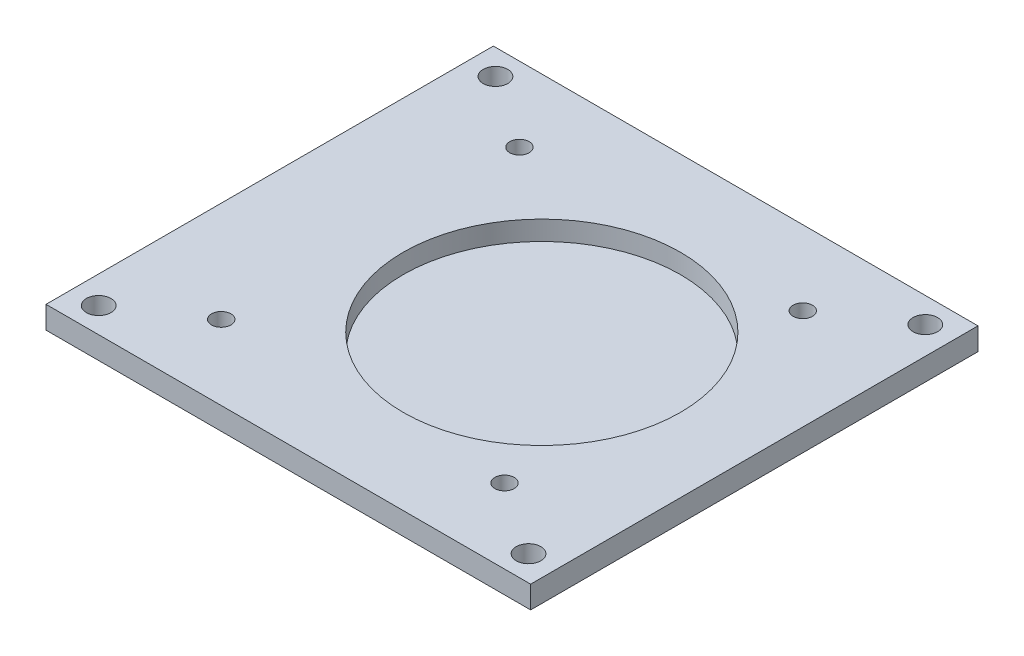
from build123d import *

# Parameters (mm, degrees)
SKETCH3_W           = 65
SKETCH3_H           = 60
BOSS_EXTRUDE3_DEPTH = 3
CUT_EXTRUDE1_REACH  = 57.839
SKETCH4_R           = 1.3
SKETCH9_R           = 3.2
SKETCH9_R_2         = 1.6
BOSS_EXTRUDE5_DEPTH = 5.6
SKETCH10_R          = 18.6
CUT_EXTRUDE3_DEPTH  = 2.6
SKETCH11_R          = 1.65
CUT_EXTRUDE4_DEPTH  = 57.41772771
FILLET1_R           = 1


with BuildPart() as part:
    # Sketch3 → Boss-Extrude3 (new body)
    with BuildSketch(Plane(origin=(0, 0, 0), x_dir=(1, 0, 0), z_dir=(0, 1, 0))):
        with Locations((-14.5, 0)):
            Rectangle(SKETCH3_W, SKETCH3_H)
    extrude(amount=BOSS_EXTRUDE3_DEPTH)

    # Sketch4 → Cut-Extrude1 (cut, up to next)
    with BuildSketch(Plane(origin=(0, 3, 0), x_dir=(1, 0, 0), z_dir=(0, 1, 0)), mode=Mode.PRIVATE) as cut_extrude1_sk1:
        with Locations((-33.5, 20)):
            Circle(SKETCH4_R)
    cut_extrude1_tool1 = extrude(cut_extrude1_sk1.sketch, amount=-CUT_EXTRUDE1_REACH, mode=Mode.PRIVATE) & part.part
    # Sketch4 → Cut-Extrude1 (cut, up to next)
    with BuildSketch(Plane(origin=(0, 3, 0), x_dir=(1, 0, 0), z_dir=(0, 1, 0)), mode=Mode.PRIVATE) as cut_extrude1_sk2:
        with Locations((4.5, 20)):
            Circle(SKETCH4_R)
    cut_extrude1_tool2 = extrude(cut_extrude1_sk2.sketch, amount=-CUT_EXTRUDE1_REACH, mode=Mode.PRIVATE) & part.part
    # Sketch4 → Cut-Extrude1 (cut, up to next)
    with BuildSketch(Plane(origin=(0, 3, 0), x_dir=(1, 0, 0), z_dir=(0, 1, 0)), mode=Mode.PRIVATE) as cut_extrude1_sk3:
        with Locations((4.5, -20)):
            Circle(SKETCH4_R)
    cut_extrude1_tool3 = extrude(cut_extrude1_sk3.sketch, amount=-CUT_EXTRUDE1_REACH, mode=Mode.PRIVATE) & part.part
    # Sketch4 → Cut-Extrude1 (cut, up to next)
    with BuildSketch(Plane(origin=(0, 3, 0), x_dir=(1, 0, 0), z_dir=(0, 1, 0)), mode=Mode.PRIVATE) as cut_extrude1_sk4:
        with Locations((-33.5, -20)):
            Circle(SKETCH4_R)
    cut_extrude1_tool4 = extrude(cut_extrude1_sk4.sketch, amount=-CUT_EXTRUDE1_REACH, mode=Mode.PRIVATE) & part.part
    add(cut_extrude1_tool1.solids().sort_by_distance((-33.5, 3, -20))[0], mode=Mode.SUBTRACT)
    add(cut_extrude1_tool2.solids().sort_by_distance((4.5, 3, -20))[0], mode=Mode.SUBTRACT)
    add(cut_extrude1_tool3.solids().sort_by_distance((4.5, 3, 20))[0], mode=Mode.SUBTRACT)
    add(cut_extrude1_tool4.solids().sort_by_distance((-33.5, 3, 20))[0], mode=Mode.SUBTRACT)

    # Sketch9 → Boss-Extrude5 (add)
    # profile 1 of 4: a face of its own
    with BuildSketch(Plane.XZ):
        with Locations((-33.5, 20)):
            Circle(SKETCH9_R)
        with Locations((-33.5, 20)):
            Circle(SKETCH9_R_2, mode=Mode.SUBTRACT)
    # profile 2 of 4: a face of its own
    with BuildSketch(Plane.XZ):
        with Locations((-33.5, -20)):
            Circle(SKETCH9_R)
        with Locations((-33.5, -20)):
            Circle(SKETCH9_R_2, mode=Mode.SUBTRACT)
    # profile 3 of 4: a face of its own
    with BuildSketch(Plane.XZ):
        with Locations((4.5, 20)):
            Circle(SKETCH9_R)
        with Locations((4.5, 20)):
            Circle(SKETCH9_R_2, mode=Mode.SUBTRACT)
    # profile 4 of 4: a face of its own
    with BuildSketch(Plane.XZ):
        with Locations((4.5, -20)):
            Circle(SKETCH9_R)
        with Locations((4.5, -20)):
            Circle(SKETCH9_R_2, mode=Mode.SUBTRACT)
    extrude(amount=BOSS_EXTRUDE5_DEPTH)

    # Sketch10 → Cut-Extrude3 (cut)
    with BuildSketch(Plane(origin=(0, 3, 0), x_dir=(1, 0, 0), z_dir=(0, 1, 0))):
        with Locations((-10.5, 0)):
            Circle(SKETCH10_R)
    extrude(amount=-CUT_EXTRUDE3_DEPTH, mode=Mode.SUBTRACT)

    # Sketch11 → Cut-Extrude4 (cut, through all)
    with BuildSketch(Plane(origin=(0, 3, 0), x_dir=(1, 0, 0), z_dir=(0, 1, 0))):
        with Locations((14.325982777, -26.608599486)):
            Circle(SKETCH11_R)
        with Locations((-43.325982777, -26.608599486)):
            Circle(SKETCH11_R)
        with Locations((14.325982777, 26.608599486)):
            Circle(SKETCH11_R)
        with Locations((-43.325982777, 26.608599486)):
            Circle(SKETCH11_R)
    extrude(amount=-CUT_EXTRUDE4_DEPTH, mode=Mode.SUBTRACT)

    # Fillet1
    fillet1_edges = [part.edges().sort_by_distance(p)[0] for p in [
        (-35.1, -5.6, -20),
        (2.9, -5.6, -20),
        (-35.1, -5.6, 20),
        (2.9, -5.6, 20),
    ]]
    fillet(fillet1_edges, radius=FILLET1_R)


solid = part.part
